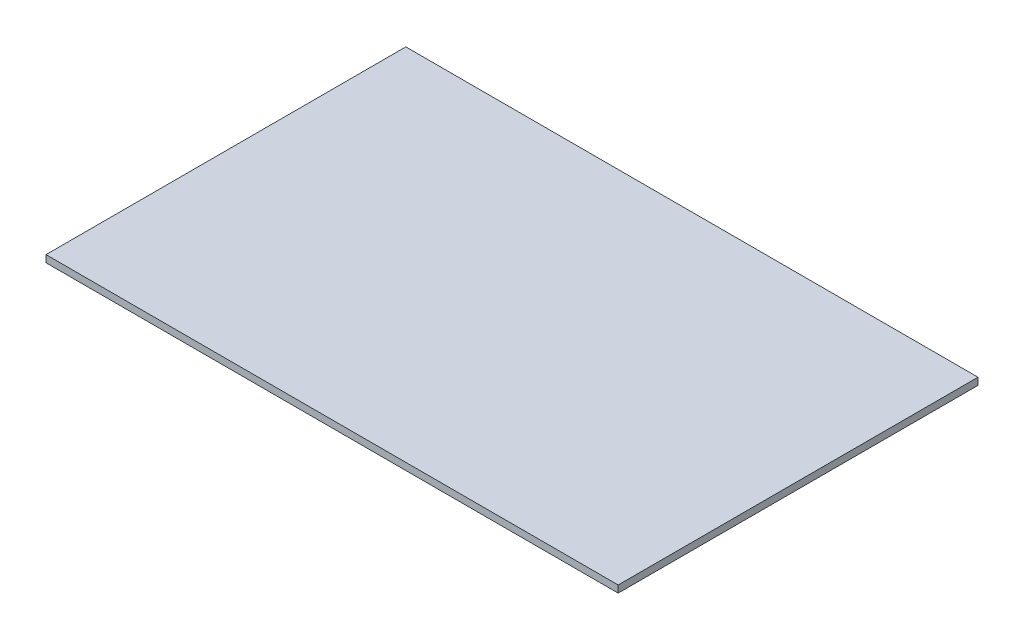
from build123d import *

# Parameters (mm, degrees)
SKETCH1_W           = 970
SKETCH1_H           = 610
BOSS_EXTRUDE1_DEPTH = 12


with BuildPart() as part:
    # Sketch1 → Boss-Extrude1 (new body)
    with BuildSketch(Plane(origin=(0, 0, 0), x_dir=(1, 0, 0), z_dir=(0, 1, 0))):
        with Locations((-192.306733167, 56.633416459)):
            Rectangle(SKETCH1_W, SKETCH1_H)
    extrude(amount=BOSS_EXTRUDE1_DEPTH)


solid = part.part
